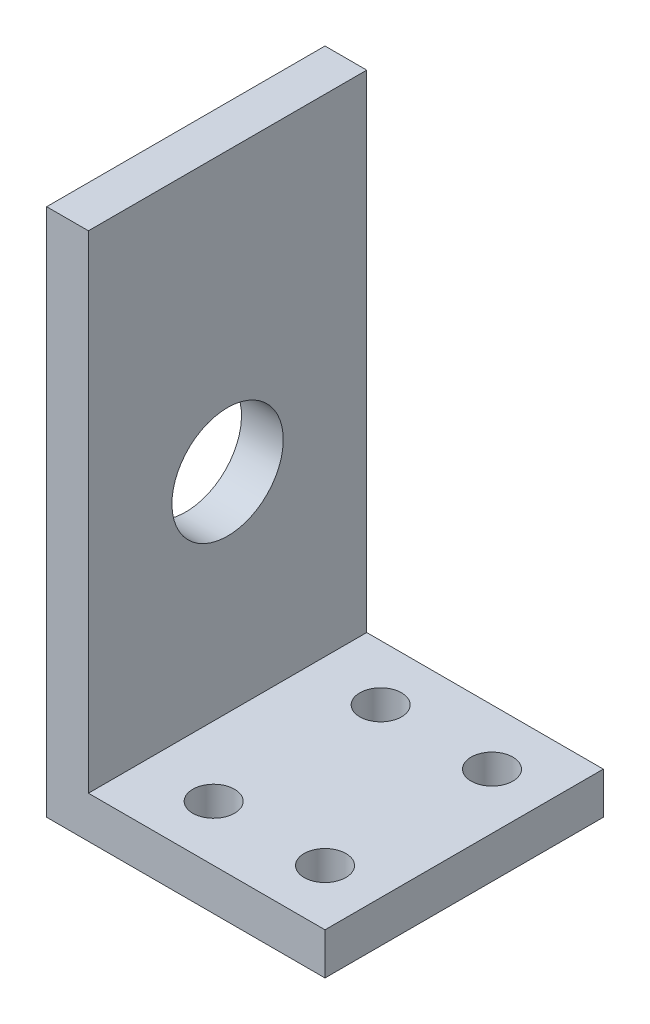
from build123d import *

# Parameters (mm, degrees)
EXTRUDE_1_DEPTH     = 20
SKETCH_2_R          = 1.5
CUT_EXTRUDE_1_DEPTH = 46
SKETCH_3_R          = 4
CUT_EXTRUDE_2_DEPTH = 47.184412955
SKETCH_4_R          = 1.5
CUT_EXTRUDE_3_DEPTH = 20


with BuildPart() as part:
    # 草图1 → 凸台-拉伸1 (new body)
    with BuildSketch(Plane.XY):
        Polygon((0, 0), (0, 38), (3, 38), (3, 3), (20, 3), (20, 0), align=None)
    extrude(amount=EXTRUDE_1_DEPTH)

    # 草图2 → 切除-拉伸1 (cut, through all)
    with BuildSketch(Plane(origin=(0, 3, 0), x_dir=(1, 0, 0), z_dir=(0, 1, 0))):
        with Locations((16, -16)):
            Circle(SKETCH_2_R)
        with Locations((16, -4)):
            Circle(SKETCH_2_R)
    extrude(amount=-CUT_EXTRUDE_1_DEPTH, mode=Mode.SUBTRACT)

    # 草图3 → 切除-拉伸2 (cut, through all)
    with BuildSketch(Plane(origin=(3, 0, 0), x_dir=(0, 0, -1), z_dir=(1, 0, 0))):
        with Locations((-10, 18)):
            Circle(SKETCH_3_R)
    extrude(amount=-CUT_EXTRUDE_2_DEPTH, mode=Mode.SUBTRACT)

    # 草图4 → 切除-拉伸3 (cut)
    with BuildSketch(Plane(origin=(0, 3, 0), x_dir=(1, 0, 0), z_dir=(0, 1, 0))):
        with Locations((8, -16)):
            Circle(SKETCH_4_R)
        with Locations((8, -4)):
            Circle(SKETCH_4_R)
    extrude(amount=-CUT_EXTRUDE_3_DEPTH, mode=Mode.SUBTRACT)


solid = part.part
